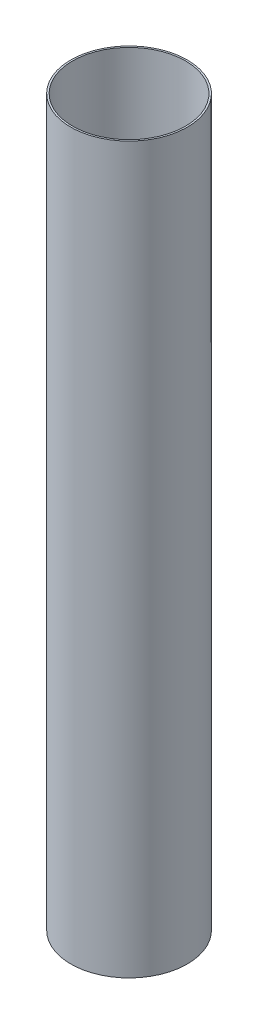
from build123d import *

# Parameters (mm, degrees)
SKETCH1_R           = 51.054
SKETCH1_R_2         = 49.53
BOSS_EXTRUDE1_DEPTH = 635


with BuildPart() as part:
    # Sketch1 → Boss-Extrude1 (new body)
    with BuildSketch(Plane(origin=(0, 150, 0), x_dir=(1, 0, 0), z_dir=(0, 1, 0))):
        Circle(SKETCH1_R)
        Circle(SKETCH1_R_2, mode=Mode.SUBTRACT)
    extrude(amount=BOSS_EXTRUDE1_DEPTH)


solid = part.part
